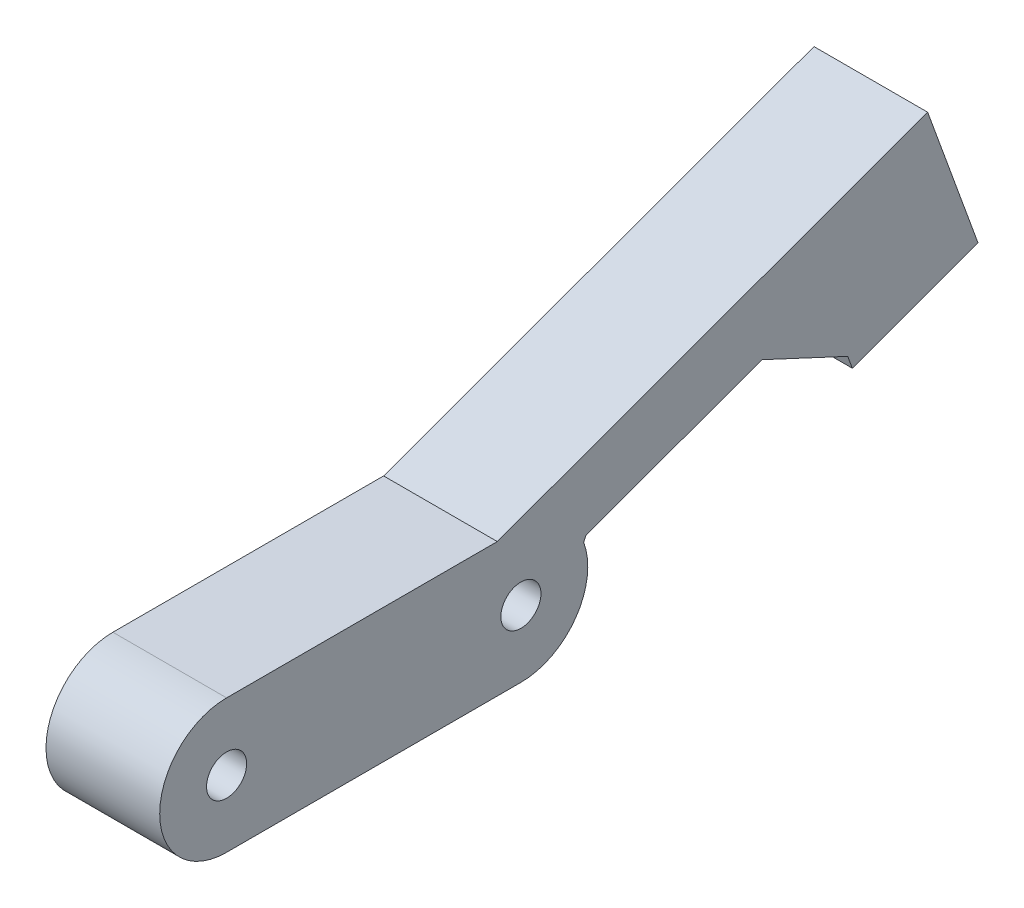
from build123d import *

# Parameters (mm, degrees)
SKETCH1_R           = 1.5
BOSS_EXTRUDE1_DEPTH = 8.5
BOSS_EXTRUDE2_START = -8.5
BOSS_EXTRUDE2_DEPTH = 8.5


with BuildPart() as part:
    # Sketch1 → Boss-Extrude1 (new body)
    with BuildSketch(Plane(origin=(0, 0, 0), x_dir=(0, 0, -1), z_dir=(1, 0, 0))):
        with BuildLine():
            Line((27, 10), (5, 10))
            ThreePointArc((5, 10), (0, 5), (5, 0))
            Line((5, 0), (27, 0))
            ThreePointArc((27, 0), (32, 5), (27, 10))
        make_face()
        with Locations((5, 5)):
            Circle(SKETCH1_R, mode=Mode.SUBTRACT)
        with Locations((27, 5)):
            Circle(SKETCH1_R, mode=Mode.SUBTRACT)
    extrude(amount=BOSS_EXTRUDE1_DEPTH)

    # Sketch2 → Boss-Extrude2 (add)
    with BuildSketch(Plane(origin=(8.5, 0, 0), x_dir=(0, 0, -1), z_dir=(1, 0, 0)).offset(BOSS_EXTRUDE2_START)):
        with BuildLine():
            ThreePointArc((27, 10), (29.863119288, 9.099091112), (31.69447473, 6.721019177))
            Line((31.69447473, 6.721019177), (31.867747629, 7.092604107))
            Line((31.867747629, 7.092604107), (45.02344432, 11.880886114))
            Line((45.02344432, 11.880886114), (51.43200814, 8.892523726))
            Line((51.43200814, 8.892523726), (51.774028284, 7.952831106))
            Line((51.774028284, 7.952831106), (61.170954492, 11.373032539))
            Line((61.170954492, 11.373032539), (57.408732915, 21.709651368))
            Line((57.408732915, 21.709651368), (25.236730193, 10))
            Line((25.236730193, 10), (27, 10))
        make_face()
    extrude(amount=BOSS_EXTRUDE2_DEPTH)


solid = part.part
